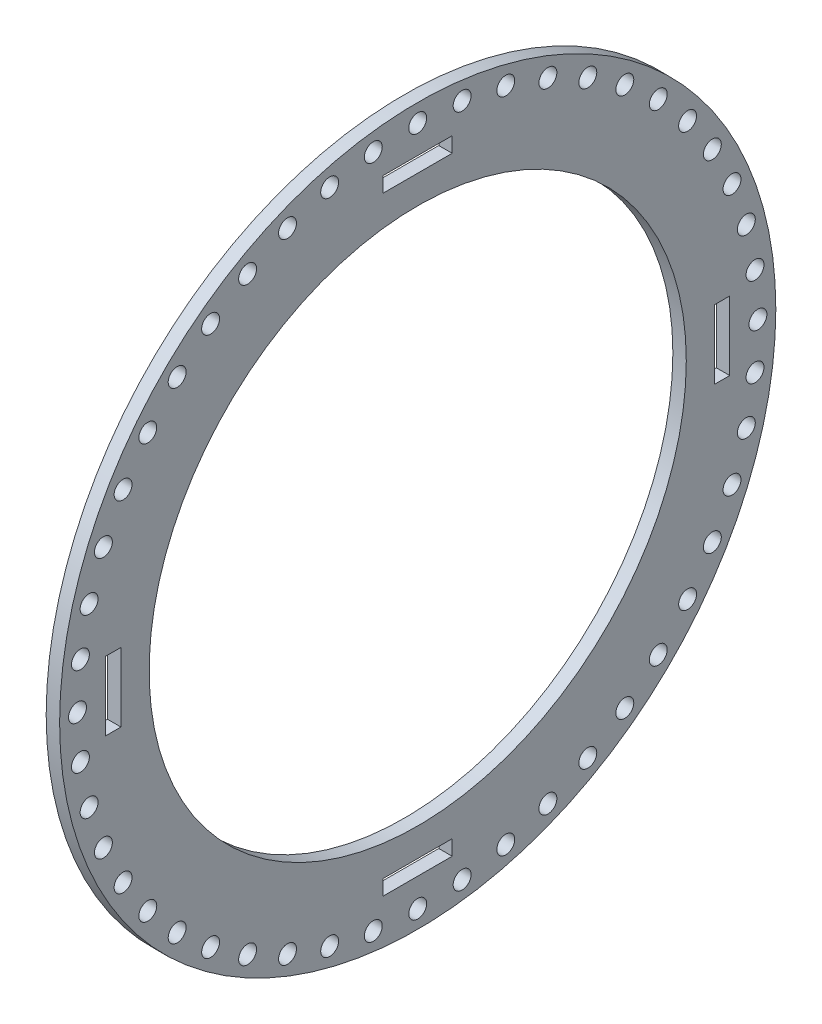
from build123d import *

# Parameters (mm, degrees)
SKETCH1_R           = 40
SKETCH1_R_2         = 30
SKETCH1_W           = 7.7
SKETCH1_H           = 1.7
SKETCH1_W_2         = 1.7
SKETCH1_H_2         = 7.7
BOSS_EXTRUDE4_DEPTH = 1.5
SKETCH2_R           = 1
CUT_EXTRUDE2_DEPTH  = 1.5
CIRPATTERN3_COUNT   = 48


with BuildPart() as part:
    # Sketch1 → Boss-Extrude4 (new body)
    with BuildSketch(Plane(origin=(0, 0, 0), x_dir=(0, 0, -1), z_dir=(1, 0, 0))):
        Circle(SKETCH1_R)
        Circle(SKETCH1_R_2, mode=Mode.SUBTRACT)
        with Locations((0, 34)):
            Rectangle(SKETCH1_W, SKETCH1_H, mode=Mode.SUBTRACT)
        with Locations((34, 0)):
            Rectangle(SKETCH1_W_2, SKETCH1_H_2, mode=Mode.SUBTRACT)
        with Locations((0, -34)):
            Rectangle(SKETCH1_W, SKETCH1_H, mode=Mode.SUBTRACT)
        with Locations((-34, 0)):
            Rectangle(SKETCH1_W_2, SKETCH1_H_2, mode=Mode.SUBTRACT)
    extrude(amount=BOSS_EXTRUDE4_DEPTH)

    # Sketch2 → Cut-Extrude2 (cut)
    with BuildSketch(Plane(origin=(1.5, 0, 0), x_dir=(0, 0, -1), z_dir=(1, 0, 0))):
        with Locations((0, 38)):
            Circle(SKETCH2_R)
    cut_extrude2 = extrude(amount=-CUT_EXTRUDE2_DEPTH, mode=Mode.SUBTRACT)

    # CirPattern3: Cut-Extrude2 ×48 about axis
    cirpattern3_axis = Axis((1.5, 0, 0), (1, 0, 0))
    for i in range(1, CIRPATTERN3_COUNT):
        add(cut_extrude2.rotate(cirpattern3_axis, i * 360 / CIRPATTERN3_COUNT), mode=Mode.SUBTRACT)


solid = part.part
